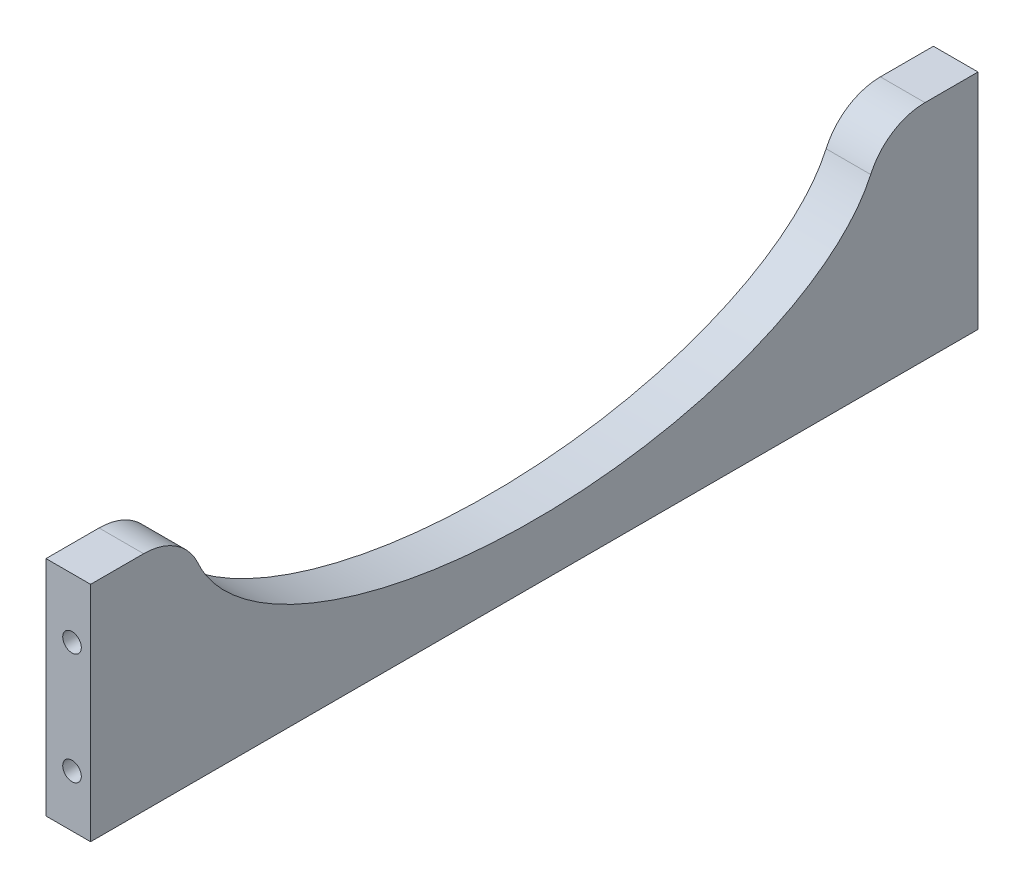
from build123d import *

# Parameters (mm, degrees)
SKETCH_3_W          = 6
SKETCH_3_H          = 30
EXTRUDE_1_DEPTH     = 119.4
SKETCH_4_RX         = 46.310154036
SKETCH_4_RY         = 22.366189945
CUT_EXTRUDE_1_DEPTH = 124.257291874
FILLET_START        = -84
FILLET_1_DEPTH      = 8
SKETCH_5_R          = 1.25
CUT_EXTRUDE_2_DEPTH = 10
CUT_EXTRUDE_START   = -10
SKETCH_6_R          = 1.25
CUT_EXTRUDE_3_DEPTH = 10


with BuildPart() as part:
    # 草图3 → 凸台-拉伸1 (new body)
    with BuildSketch(Plane.XY):
        with Locations((-80.4, 15)):
            Rectangle(SKETCH_3_W, SKETCH_3_H)
    extrude(amount=EXTRUDE_1_DEPTH)

    # 草图4 → 切除-拉伸1 (cut, through all)
    with BuildSketch(Plane.ZY.offset(83.4)):
        with Locations((59.7, 30)):
            Ellipse(SKETCH_4_RX, SKETCH_4_RY)
    extrude(amount=-CUT_EXTRUDE_1_DEPTH, mode=Mode.SUBTRACT)

    # 圆角1: read off the stored shape, not the designer's step
    # 圆角1 outline → 圆角1 (cut)
    with BuildSketch(Plane.YZ.offset(FILLET_START)):
        with BuildLine():
            Line((30, 106.010154036), (30, 112.263898035))
            ThreePointArc((30, 112.263898035), (28.714319891, 107.914425838), (25.270522901, 104.962961112))
            add(Edge.make_bspline(
                [(25.270522901, 104.962961112), (27.608219262, 106.010154036), (30, 106.010154036)],
                knots=[6.05570643, 6.05570643, 6.05570643, 6.283185307, 6.283185307, 6.283185307], degree=2, weights=[0.927453028, 0.957583921, 1]))
        make_face()
        with BuildLine():
            add(Edge.make_bspline(
                [(30, 13.389845964), (27.608219262, 13.389845964), (25.270522901, 14.437038888)],
                knots=[3.141592654, 3.141592654, 3.141592654, 3.369071531, 3.369071531, 3.369071531], degree=2, weights=[1, 0.957583921, 0.927453028]))
            ThreePointArc((25.270522901, 14.437038888), (28.714319891, 11.485574162), (30, 7.136101965))
            Line((30, 7.136101965), (30, 13.389845964))
        make_face()
    extrude(amount=FILLET_1_DEPTH, mode=Mode.SUBTRACT)

    # 草图5 → 切除-拉伸2 (cut)
    with BuildSketch(Plane.XY.offset(119.4)):
        with Locations((-79.9, 22)):
            Circle(SKETCH_5_R)
        with Locations((-79.9, 7)):
            Circle(SKETCH_5_R)
    extrude(amount=-CUT_EXTRUDE_2_DEPTH, mode=Mode.SUBTRACT)

    # 草图6 → 切除-拉伸3 (cut)
    with BuildSketch(Plane(origin=(0, 0, 0), x_dir=(-1, 0, 0), z_dir=(0, 0, -1)).offset(CUT_EXTRUDE_START)):
        with Locations(Location((79.9, 22, 0), (0, 0, 180))):
            Circle(SKETCH_6_R)
        with Locations(Location((79.9, 7, 0), (0, 0, 180))):
            Circle(SKETCH_6_R)
    extrude(amount=CUT_EXTRUDE_3_DEPTH, mode=Mode.SUBTRACT)


solid = part.part
